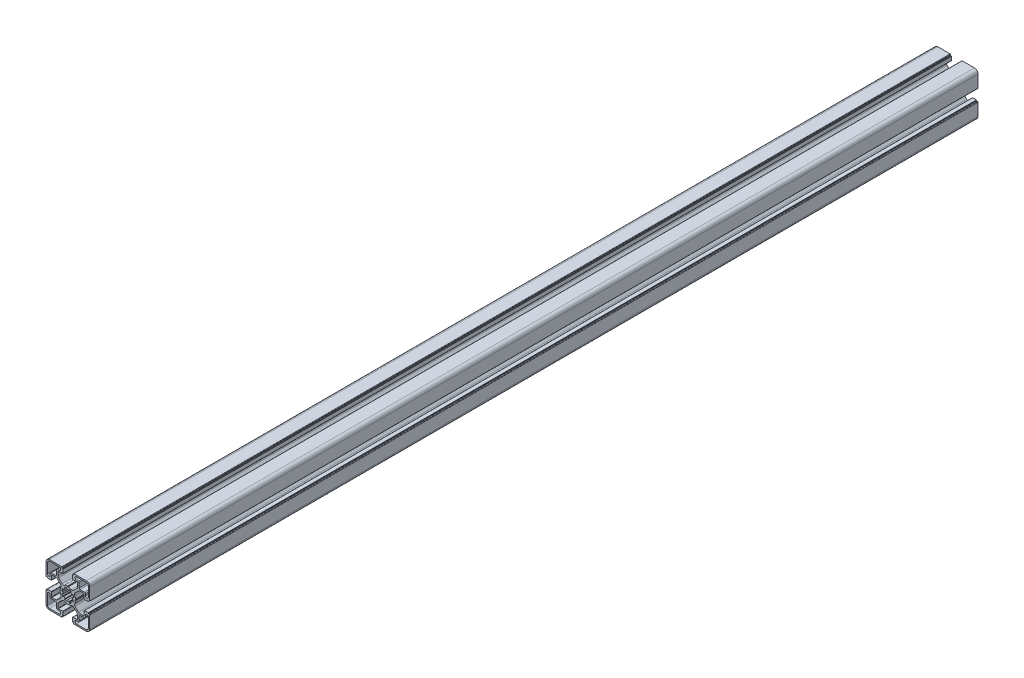
from build123d import *

# Parameters (mm, degrees)
BOSS_EXTRUDE1_DEPTH      = 457.2
FILLET4_R                = 1.885
FILLET5_R                = 0.377
DELETEFACE1_START        = -457.2
DELETEFACE1_DEPTH        = 914.4
CUT_EXTRUDE1_START       = -457.2
CUT_EXTRUDE1_DEPTH       = 914.4
CIRPATTERN2_COUNT        = 3
CIRPATTERN2_ANGLE        = 180
FILLET2_R                = 0.377
FILLET3_R                = 0.1885
CUT_EXTRUDE2_DEPTH       = 915.953474227
CUT_EXTRUDE2_DEPTH_BACK  = 915.953474227
SKETCH5_R                = 6.375
BOSS_EXTRUDE2_DEPTH      = 457.2
FILLET6_R                = 0.377
CIRPATTERN1_COUNT        = 8
FILLET6_OF_CIRPATTERN1_R = 0.377
CUT_EXTRUDE3_DEPTH       = 459.305945848
CUT_EXTRUDE3_DEPTH_BACK  = 459.305945848


# Read off the part's stored shape, not the designer's step: DeleteFace1
with BuildPart() as part:
    # Sketch3 → Boss-Extrude1 (new, symmetric)
    with BuildSketch(Plane.XY):
        with BuildLine():
            Line((0, -8), (0, -5))
            ThreePointArc((0, -5), (3.535533906, -3.535533906), (5, 0))
            Line((5, 0), (8, 0))
            ThreePointArc((8, 0), (7.57237156, -2.58054044), (6.335202759, -4.885202759))
            Line((6.335202759, -4.885202759), (11.5, -10.05))
            Line((11.5, -10.05), (16.7, -10.05))
            Line((16.7, -10.05), (16.7, -5))
            Line((16.7, -5), (21.05, -5))
            Line((21.05, -5), (21.05, 0))
            Line((21.05, 0), (22.5, 0))
            Line((22.5, 0), (22.5, -18.875))
            ThreePointArc((22.5, -18.875), (21.438262082, -21.438262082), (18.875, -22.5))
            Line((18.875, -22.5), (0, -22.5))
            Line((0, -22.5), (0, -21.05))
            Line((0, -21.05), (5, -21.05))
            Line((5, -21.05), (5, -16.7))
            Line((5, -16.7), (10.05, -16.7))
            Line((10.05, -16.7), (10.05, -11.5))
            Line((10.05, -11.5), (4.885202759, -6.335202759))
            ThreePointArc((4.885202759, -6.335202759), (2.58054044, -7.57237156), (0, -8))
        make_face()
        with BuildLine():
            Line((18.15, -8.79375), (18.15, -10.5575))
            ThreePointArc((18.15, -10.5575), (17.873948141, -11.223948141), (17.2075, -11.5))
            Line((17.2075, -11.5), (12.4425, -11.5))
            ThreePointArc((12.4425, -11.5), (11.776051859, -11.776051859), (11.5, -12.4425))
            Line((11.5, -12.4425), (11.5, -17.2075))
            ThreePointArc((11.5, -17.2075), (11.223948141, -17.873948141), (10.5575, -18.15))
            Line((10.5575, -18.15), (8.79375, -18.15))
            ThreePointArc((8.79375, -18.15), (7.34375, -19.6), (8.79375, -21.05))
            Line((8.79375, -21.05), (18.875, -21.05))
            ThreePointArc((18.875, -21.05), (20.412957249, -20.412957249), (21.05, -18.875))
            Line((21.05, -18.875), (21.05, -8.79375))
            ThreePointArc((21.05, -8.79375), (19.6, -7.34375), (18.15, -8.79375))
        make_face(mode=Mode.SUBTRACT)
    extrude(amount=BOSS_EXTRUDE1_DEPTH, both=True)

    # Fillet4
    fillet4_edges = [part.edges().sort_by_distance(p)[0] for p in [
        (10.05, -11.5, 0),
        (4.885202759, -6.335202759, 0),
        (6.335202759, -4.885202759, 0),
        (11.5, -10.05, 0),
    ]]
    fillet(fillet4_edges, radius=FILLET4_R)

    # Fillet5
    fillet5_edges = [part.edges().sort_by_distance(p)[0] for p in [
        (5, -21.05, 0),
        (5, -16.7, 0),
        (10.05, -16.7, 0),
        (16.7, -10.05, 0),
        (16.7, -5, 0),
        (21.05, -5, 0),
    ]]
    fillet(fillet5_edges, radius=FILLET5_R)

    # Mirror1: part across plane


with BuildPart() as part_1:
    add(part.part)
    add(part.part.mirror(Plane.ZX))

    # DeleteFace1 outline → DeleteFace1 (cut)
    with BuildSketch(Plane.XY.offset(DELETEFACE1_START)):
        with BuildLine():
            ThreePointArc((4.623, 21.05), (4.889579257, 20.939579257), (5, 20.673))
            Line((5, 20.673), (5, 21.05))
            Line((5, 21.05), (4.623, 21.05))
        make_face()
    extrude(amount=DELETEFACE1_DEPTH, mode=Mode.SUBTRACT)

    # Sketch4 → Cut-Extrude1 (cut)
    with BuildSketch(Plane.XY.offset(CUT_EXTRUDE1_START)):
        Polygon((5.85, 21.05), (5.85, 22.5), (0, 22.5), (-5.85, 22.5), (-5.85, 21.05), (-5, 21.05), (-5, 16.7), (5, 16.7), (5, 21.05), align=None)
    cut_extrude1 = extrude(amount=CUT_EXTRUDE1_DEPTH, mode=Mode.SUBTRACT)

    # CirPattern2: Cut-Extrude1 ×3 about axis
    cirpattern2_axis = Axis((0, 0, 422.2), (0, 0, -1))
    for i in range(1, CIRPATTERN2_COUNT):
        add(cut_extrude1.rotate(cirpattern2_axis, i * CIRPATTERN2_ANGLE / (CIRPATTERN2_COUNT - 1)), mode=Mode.SUBTRACT)

    # Fillet2
    fillet2_edges = [part_1.edges().sort_by_distance(p)[0] for p in [
        (5.85, 22.5, 0),
        (22.5, 5.85, 0),
        (22.5, -5.85, 0),
        (5.85, -22.5, 0),
    ]]
    fillet(fillet2_edges, radius=FILLET2_R)

    # Fillet3
    fillet3_edges = [part_1.edges().sort_by_distance(p)[0] for p in [
        (5, 21.05, 0),
        (5.85, 21.05, 0),
        (21.05, -5, 0),
        (21.05, -5.85, 0),
        (21.05, 5, 0),
        (21.05, 5.85, 0),
        (5, -21.05, 0),
        (5.85, -21.05, 0),
    ]]
    fillet(fillet3_edges, radius=FILLET3_R)

    # Mirror2: part across plane


with BuildPart() as part_2:
    add(part_1.part)
    add(part_1.part.mirror(Plane(origin=(0, 0, 0), x_dir=(0, 0, 1), z_dir=(1, 0, 0))))

    # Sketch5 → Cut-Extrude2 (cut, two sides: drawn at the far end of the back side and taken through both)
    with BuildSketch(Plane.XY.offset(457.2).offset(-CUT_EXTRUDE2_DEPTH_BACK)):
        Circle(SKETCH5_R)
        Polygon((-0.580185128, 8), (0.580185128, 8), (0, 7.59375), align=None)
        Polygon((-8, 0.580185128), (-8, -0.580185128), (-7.59375, 0), align=None)
        Polygon((8, 0.580185128), (8, -0.580185128), (7.59375, 0), align=None)
        Polygon((-0.580185128, -8), (0.580185128, -8), (0, -7.59375), align=None)
    extrude(amount=CUT_EXTRUDE2_DEPTH + CUT_EXTRUDE2_DEPTH_BACK, mode=Mode.SUBTRACT)

    # Sketch6 → Boss-Extrude2 (add, symmetric)
    with BuildSketch(Plane.XY):
        with BuildLine():
            Line((-0.97545161, -4.903926402), (-1.243700803, -6.252506163))
            ThreePointArc((-1.243700803, -6.252506163), (0, -6.375), (1.243700803, -6.252506163))
            Line((1.243700803, -6.252506163), (0.97545161, -4.903926402))
            ThreePointArc((0.97545161, -4.903926402), (0, -5), (-0.97545161, -4.903926402))
        make_face()
    boss_extrude2 = extrude(amount=BOSS_EXTRUDE2_DEPTH, both=True)

    # Fillet6
    fillet6_edges = [part_2.edges().sort_by_distance(p)[0] for p in [
        (-1.243700803, -6.252506163, 0),
        (1.243700803, -6.252506163, 0),
    ]]
    fillet(fillet6_edges, radius=FILLET6_R)

    # CirPattern1: Boss-Extrude2 ×8 about axis
    cirpattern1_axis = Axis((0, 0, 0), (0, 0, 1))
    for i in range(1, CIRPATTERN1_COUNT):
        add(boss_extrude2.rotate(cirpattern1_axis, i * 360 / CIRPATTERN1_COUNT))

    # Fillet6 of CirPattern1
    fillet6_of_cirpattern1_edges = [part_2.edges().sort_by_distance(p)[0] for p in [
        (3.541760235, -5.300618778, 0),
        (5.300618778, -3.541760235, 0),
        (6.252506163, -1.243700803, 0),
        (6.252506163, 1.243700803, 0),
        (5.300618778, 3.541760235, 0),
        (3.541760235, 5.300618778, 0),
        (1.243700803, 6.252506163, 0),
        (-1.243700803, 6.252506163, 0),
        (-3.541760235, 5.300618778, 0),
        (-5.300618778, 3.541760235, 0),
        (-6.252506163, 1.243700803, 0),
        (-6.252506163, -1.243700803, 0),
        (-5.300618778, -3.541760235, 0),
        (-3.541760235, -5.300618778, 0),
    ]]
    fillet(fillet6_of_cirpattern1_edges, radius=FILLET6_OF_CIRPATTERN1_R)

    # Sketch7 → Cut-Extrude3 (cut, two sides: drawn at the far end of the back side and taken through both)
    with BuildSketch(Plane.XY.offset(-CUT_EXTRUDE3_DEPTH_BACK)):
        Polygon((-7.031875, 16.7), (-6.596875, 17.135), (-6.161875, 16.7), align=None)
    extrude(amount=CUT_EXTRUDE3_DEPTH + CUT_EXTRUDE3_DEPTH_BACK, mode=Mode.SUBTRACT)


solid = part_2.part
